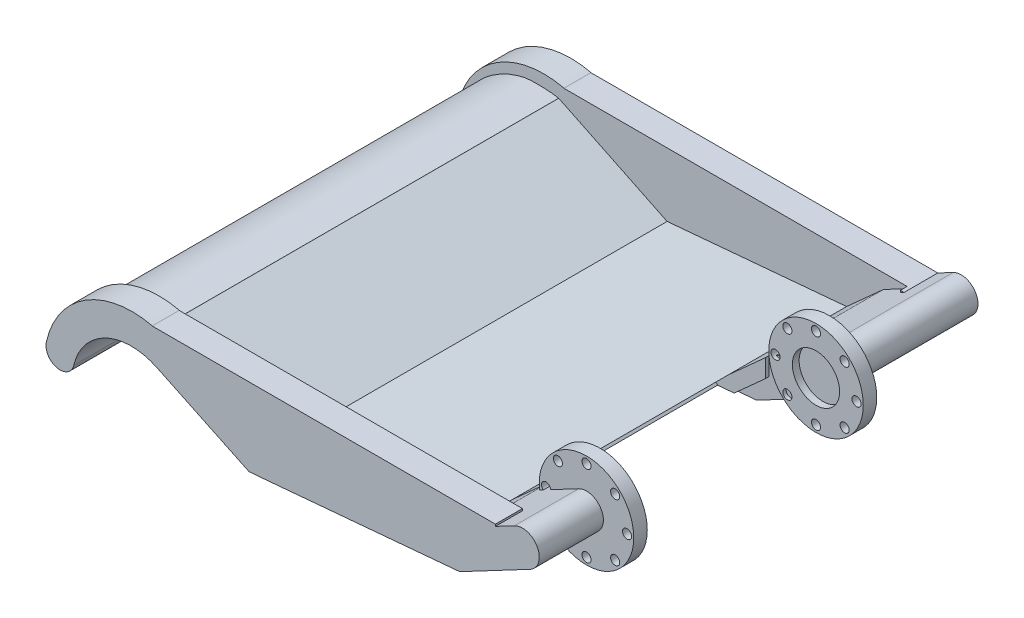
from build123d import *

# Parameters (mm, degrees)
EXTRUDE_1_DEPTH           = 150
CUT_EXTRUDE_START         = -4
CUT_EXTRUDE_1_DEPTH       = 142
EXTRUDE_2_DEPTH           = 10
EXTRUDE_3_DEPTH           = 146
CUT_EXTRUDE_2_DEPTH       = 182.252872433
CUT_EXTRUDE_2_DEPTH_BACK  = 182.252872433
SKETCH_13_W               = 7
SKETCH_13_H               = 142
CUT_EXTRUDE_3_DEPTH       = 10
CUT_EXTRUDE_4_DEPTH       = 182.247779062
CUT_EXTRUDE_4_DEPTH_BACK  = 182.247779062
CUT_EXTRUDE_5_DEPTH       = 182.247779062
CUT_EXTRUDE_5_DEPTH_BACK  = 182.247779062
CUT_EXTRUDE_6_DEPTH       = 183.008664647
CUT_EXTRUDE_6_DEPTH_BACK  = 183.008664647
EXTRUDE_4_DEPTH           = 4
EXTRUDE_START             = -150
EXTRUDE_5_DEPTH           = 4
EXTRUDE_6_DEPTH           = 142
EXTRUDE_7_DEPTH           = 33
SKETCH_23_R               = 14
SKETCH_23_R_2             = 1.35
EXTRUDE_8_DEPTH           = 4
SKETCH_24_R               = 2.5
EXTRUDE_9_DEPTH           = 4
SKETCH_25_W               = 20
SKETCH_25_H               = 64
CUT_EXTRUDE_7_DEPTH       = 4
EXTRUDE_10_DEPTH          = 4
SWEEP_START               = 4
SWEEP_1_DEPTH             = 142
SWEEP_2_DEPTH             = 142
SWEEP_4_DEPTH             = 142
SWEEP_5_DEPTH             = 142
SWEEP_6_DEPTH             = 142
EXTRUDE_13_DEPTH          = 150
EXTRUDE_START_2           = 4
EXTRUDE_14_DEPTH          = 142
EXTRUDE_15_DEPTH          = 42
SKETCH_38_W               = 150.834612216
SKETCH_38_H               = 73.301639105
CUT_EXTRUDE_10_DEPTH      = 69
EXTRUDE_16_DEPTH          = 4
SKETCH_42_R               = 7
CUT_EXTRUDE_11_DEPTH      = 2
CUT_EXTRUDE_START_2       = -2
SKETCH_43_R               = 7
CUT_EXTRUDE_12_DEPTH      = 2
CUT_EXTRUDE_13_DEPTH      = 173.219808533
CUT_EXTRUDE_13_DEPTH_BACK = 173.219808533
EXTRUDE_17_REACH          = 168.644
EXTRUDE_18_DEPTH          = 8
EXTRUDE_19_DEPTH          = 8
EXTRUDE_20_DEPTH          = 130


# Read off the part's stored shape, not the designer's step: 扫描1, 扫描2, 扫描4, 扫描5, 扫描6, 凸台-拉伸13
with BuildPart() as part:
    # 草图1 → 凸台-拉伸1 (new body)
    with BuildSketch(Plane.XY):
        with BuildLine():
            Line((0, 0), (84.371041787, 0))
            add(Edge.make_bspline(
                [(55.913923705, -38.035643557), (80.119272772, -28.628823463), (84.371041787, 0)],
                knots=[0, 0, 0, 1, 1, 1], degree=2))
            Line((55.913923705, -38.035643557), (46.3275244, -38.035643557))
            Line((46.3275244, -38.035643557), (45.93874262, -38.035643557))
            Line((45.93874262, -38.035643557), (-35.628958213, 0))
            Line((-35.628958213, 0), (0, 0))
        make_face()
    extrude(amount=EXTRUDE_1_DEPTH)

    # 草图2 → 切除-拉伸1 (cut)
    with BuildSketch(Plane.XY.offset(150).offset(CUT_EXTRUDE_START)):
        with BuildLine():
            Line((81.371041787, 0), (-28.530353464, 0))
            Line((-28.530353464, 0), (47.917706931, -35.648316013))
            add(Edge.make_bspline(
                [(47.917706931, -35.648316013), (74.149853948, -29.50839386), (81.371041787, 0)],
                knots=[0, 0, 0, 1, 1, 1], degree=2))
        make_face()
    extrude(amount=-CUT_EXTRUDE_1_DEPTH, mode=Mode.SUBTRACT)

    # 草图9 → 凸台-拉伸2 (add)
    with BuildSketch(Plane.XY):
        with BuildLine():
            Line((92.371041787, 0), (84.371041787, 0))
            add(Edge.make_bspline(
                [(83.660125503, -4), (84.066701304, -2.049243485), (84.371041787, 0)],
                knots=[0.928420269, 0.928420269, 0.928420269, 1, 1, 1], degree=2))
            Line((83.660125503, -4), (92.371041787, -4))
            ThreePointArc((92.371041787, -4), (94.371041787, -2), (92.371041787, 0))
        make_face()
    extrude_2 = extrude(amount=EXTRUDE_2_DEPTH)

    # 镜向1: 凸台-拉伸2 across plane
    add(extrude_2.mirror(Plane.XY.offset(75)))

    # 草图10 → 凸台-拉伸3 (add)
    with BuildSketch(Plane.XY.offset(150)):
        Polygon((45.886677586, -38.011365233), (83.660125513, -3.999999952), (82.12466932, 0), (41.948370108, -36.174902295), align=None)
    extrude(amount=-EXTRUDE_3_DEPTH)

    # 草图12 → 切除-拉伸2 (cut, two sides: drawn at the far end of the back side and taken through both)
    with BuildSketch(Plane.XY.offset(150).offset(-CUT_EXTRUDE_2_DEPTH_BACK)):
        Polygon((83.660125513, -3.999999952), (45.886677586, -38.011365233), (45.93874262, -38.035643557), (42.591069021, -42.580909955), (89.03622068, -36.427217632), align=None)
    extrude(amount=CUT_EXTRUDE_2_DEPTH + CUT_EXTRUDE_2_DEPTH_BACK, mode=Mode.SUBTRACT)

    # 草图13 → 切除-拉伸3 (cut)
    with BuildSketch(Plane(origin=(0, 0, 0), x_dir=(1, 0, 0), z_dir=(0, 1, 0))):
        with Locations((80.871041787, -75)):
            Rectangle(SKETCH_13_W, SKETCH_13_H)
    extrude(amount=-CUT_EXTRUDE_3_DEPTH, mode=Mode.SUBTRACT)

    # 草图15 → 切除-拉伸4 (cut, two sides: drawn at the far end of the back side and taken through both)
    with BuildSketch(Plane.XY.offset(150).offset(-CUT_EXTRUDE_4_DEPTH_BACK)):
        Polygon((-25.628958213, 0), (-25.628958213, -4.663076582), (-35.628958213, 0), align=None)
    extrude(amount=CUT_EXTRUDE_4_DEPTH + CUT_EXTRUDE_4_DEPTH_BACK, mode=Mode.SUBTRACT)

    # 草图17 → 切除-拉伸5 (cut, two sides: drawn at the far end of the back side and taken through both)
    with BuildSketch(Plane.XY.offset(150).offset(-CUT_EXTRUDE_5_DEPTH_BACK)):
        Polygon((45.886677586, -38.011365233), (-32.628958213, 0), (-39.208724499, 3.812604094), (-30.674699475, -18.213608816), align=None)
    extrude(amount=CUT_EXTRUDE_5_DEPTH + CUT_EXTRUDE_5_DEPTH_BACK, mode=Mode.SUBTRACT)

    # 草图19 → 切除-拉伸6 (cut, two sides: drawn at the far end of the back side and taken through both)
    with BuildSketch(Plane(origin=(-5.095697879, -10.927759366, 0), x_dir=(0.9063077870366788, -0.42261826174063777, 0), z_dir=(0.42261826174063777, 0.9063077870366788, 0)).offset(-CUT_EXTRUDE_6_DEPTH_BACK)):
        Polygon((-15.723057795, -4), (-15.723057795, 15.181197201), (-71.912310166, 15.181197201), (-28.952648141, -153.791833671), (-15.723057795, -153.791833671), align=None)
    extrude(amount=CUT_EXTRUDE_6_DEPTH + CUT_EXTRUDE_6_DEPTH_BACK, mode=Mode.SUBTRACT)

    # 草图20 → 凸台-拉伸4 (add)
    with BuildSketch(Plane(origin=(0, 0, 0), x_dir=(-1, 0, 0), z_dir=(0, 0, -1))):
        with BuildLine():
            Line((17.34847479, 0), (20.162737711, -6.03520631))
            add(Edge.make_bspline(
                [(20.162737711, -6.03520631), (22.66067339, -5.652547732), (27.363174773, -5.662392353), (30.160749267, -6.292319916), (35.979648976, -8.083174558), (40.608616668, -12.707453996)],
                knots=[0, 0, 0, 0, 0.459648514, 0.559648514, 1, 1, 1, 1], degree=3))
            add(Edge.make_bspline(
                [(17.34847479, 0), (19.92205597, 0), (24.300461519, 0.17777387), (32.199837859, -1.721775175), (39.374446968, -6.481992043), (40.608616668, -12.707453996)],
                knots=[0, 0, 0, 0, 0.365909974, 0.465909974, 1, 1, 1, 1], degree=3))
        make_face()
    extrude(amount=-EXTRUDE_4_DEPTH)

    # 草图20<2> → 凸台-拉伸5 (add)
    with BuildSketch(Plane(origin=(0, 0, 0), x_dir=(-1, 0, 0), z_dir=(0, 0, -1)).offset(EXTRUDE_START)):
        with BuildLine():
            add(Edge.make_bspline(
                [(17.34847479, 0), (19.92205597, 0), (24.300461519, 0.17777387), (32.199837859, -1.721775175), (39.374446968, -6.481992043), (40.608616668, -12.707453996)],
                knots=[0, 0, 0, 0, 0.365909974, 0.465909974, 1, 1, 1, 1], degree=3))
            Line((17.34847479, 0), (20.162737711, -6.03520631))
            add(Edge.make_bspline(
                [(20.162737711, -6.03520631), (22.66067339, -5.652547732), (27.363174773, -5.662392353), (30.160749267, -6.292319916), (35.979648976, -8.083174558), (40.608616668, -12.707453996)],
                knots=[0, 0, 0, 0, 0.459648514, 0.559648514, 1, 1, 1, 1], degree=3))
        make_face()
    extrude(amount=EXTRUDE_5_DEPTH)

    # 草图21 → 凸台-拉伸6 (add)
    with BuildSketch(Plane.XY.offset(4)):
        Polygon((45.886677586, -38.011365233), (48.294049161, -35.843758131), (-18.855499618, -3.334997324), (-20.162737711, -6.03520631), align=None)
    extrude(amount=EXTRUDE_6_DEPTH)


with BuildPart() as body_2:
    # 草图22 → 凸台-拉伸7 (new body)
    with BuildSketch(Plane.XY.offset(10)):
        with BuildLine():
            ThreePointArc((92.371041787, 0), (90.371041787, -2), (92.371041787, -4))
            ThreePointArc((92.371041787, -4), (93.785255349, -3.414213562), (94.371041787, -2))
            ThreePointArc((94.371041787, -2), (93.785255349, -0.585786438), (92.371041787, 0))
        make_face()
    extrude_7 = extrude(amount=EXTRUDE_7_DEPTH)


with BuildPart() as body_3:
    # 草图23 → 凸台-拉伸8 (new body)
    with BuildSketch(Plane.XY.offset(43)):
        with Locations((92.371041787, -2)):
            Circle(SKETCH_23_R)
        with Locations((92.371041787, 10)):
            Circle(SKETCH_23_R_2, mode=Mode.SUBTRACT)
        with Locations((100.856323161, 6.485281374)):
            Circle(SKETCH_23_R_2, mode=Mode.SUBTRACT)
        with Locations((104.371041787, -2)):
            Circle(SKETCH_23_R_2, mode=Mode.SUBTRACT)
        with Locations((100.856323161, -10.485281374)):
            Circle(SKETCH_23_R_2, mode=Mode.SUBTRACT)
        with Locations((92.371041787, -14)):
            Circle(SKETCH_23_R_2, mode=Mode.SUBTRACT)
        with Locations((83.885760413, -10.485281374)):
            Circle(SKETCH_23_R_2, mode=Mode.SUBTRACT)
        with Locations((80.371041787, -2)):
            Circle(SKETCH_23_R_2, mode=Mode.SUBTRACT)
        with Locations((83.885760413, 6.485281374)):
            Circle(SKETCH_23_R_2, mode=Mode.SUBTRACT)
    extrude_8 = extrude(amount=-EXTRUDE_8_DEPTH)


with BuildPart() as part_1:
    add(part.part)

    # 镜向2: 凸台-拉伸7 across plane
    add(extrude_7.mirror(Plane.XY.offset(75)))

    # 镜向3: 凸台-拉伸8 across plane
    add(extrude_8.mirror(Plane.XY.offset(75)))

    # 草图25 → 切除-拉伸7 (cut)
    with BuildSketch(Plane(origin=(36.77015192, -40.837390894, 0), x_dir=(0.7431448254773977, 0.6691306063588546, 0), z_dir=(-0.6691306063588546, 0.7431448254773977, 0))):
        with Locations((44.633886256, -75)):
            Rectangle(SKETCH_25_W, SKETCH_25_H)
    extrude(amount=-CUT_EXTRUDE_7_DEPTH, mode=Mode.SUBTRACT)



with BuildPart() as body_4:
    # 草图24 → 凸台-拉伸9 (new body)
    with BuildSketch(Plane.XY.offset(150)):
        with Locations((-46.162737711, -20)):
            Circle(SKETCH_24_R)
    extrude(amount=-EXTRUDE_9_DEPTH)


with BuildPart() as body_5:
    # 镜向5: mirrored copy
    add(body_4.part.mirror(Plane.XY.offset(75)))


with BuildPart() as part_2:
    add(part_1.part)

    add(body_4.part)  # 凸台-拉伸10 merges body 4
    # 草图30 → 凸台-拉伸10 (add)
    with BuildSketch(Plane.XY.offset(150)):
        with BuildLine():
            add(Edge.make_bspline(
                [(-17.361804974, 1.243e-06), (-19.933921762, 0.00047988), (-24.305449129, 0.176574508), (-32.199837859, -1.721775175), (-39.374446968, -6.481992043), (-40.608616668, -12.707453996)],
                knots=[0.000631393, 0.000631393, 0.000631393, 0.000631393, 0.365909974, 0.465909974, 1, 1, 1, 1], degree=3))
            Line((-17.361804974, 1.243e-06), (-17.286541526, 0.044151217))
            ThreePointArc((-17.286541526, 0.044151217), (-36.995473472, -3.185414802), (-48.599294605, -19.440365745))
            ThreePointArc((-48.599294605, -19.440365745), (-46.194749763, -17.500204963), (-43.741310686, -19.37815503))
            ThreePointArc((-43.741310686, -19.37815503), (-42.101235507, -15.27422661), (-39.525601088, -11.682822647))
            add(Edge.make_bspline(
                [(-39.525601088, -11.682822647), (-39.886354477, -12.0058354), (-40.24782898, -12.347031717), (-40.608616668, -12.707453996)],
                knots=[0.96567844, 0.96567844, 0.96567844, 0.96567844, 1, 1, 1, 1], degree=3))
        make_face()
    extrude_10 = extrude(amount=-EXTRUDE_10_DEPTH)

    # 镜向7: 凸台-拉伸10 across plane
    add(extrude_10.mirror(Plane.XY.offset(75)))

    # 扫描1 outline → 扫描1 (add)
    with BuildSketch(Plane.XY.offset(SWEEP_START)):
        with BuildLine():
            Line((-40.359499641, -9.938451278), (-39.525601088, -11.682822647))
            add(Edge.make_bspline(
                [(-39.525601088, -11.682822647), (-37.391713968, -9.772174618), (-35.283057384, -8.497737422), (-31.698971246, -6.78981865), (-30.223541725, -6.356337092), (-28.92883316, -6.014930371), (-28.649075758, -5.951937626), (-27.396040293, -5.780259789), (-25.993917265, -5.718425153), (-23.001749877, -5.750233764), (-21.411705546, -5.843877026), (-20.162737711, -6.03520631)],
                knots=[0, 0, 0, 0, 0.210230398, 0.210230398, 0.420460797, 0.420460797, 0.524014936, 0.524014936, 0.762007468, 0.762007468, 1, 1, 1, 1], degree=3))
            Line((-20.162737711, -6.03520631), (-19.345627594, -4.282908011))
            add(Edge.make_bspline(
                [(-40.359499641, -9.938451278), (-38.03938458, -7.938537704), (-35.747801683, -6.614334919), (-31.851708044, -4.855945924), (-30.234072212, -4.421931688), (-28.847183327, -4.082968243), (-28.444896136, -4.027547987), (-26.923919783, -3.895861941), (-25.495125385, -3.849255475), (-22.376450407, -3.919499158), (-20.725652055, -4.028782308), (-19.345627594, -4.282908011)],
                knots=[0, 0, 0, 0, 0.210230398, 0.210230398, 0.420460797, 0.420460797, 0.524014936, 0.524014936, 0.762007468, 0.762007468, 1, 1, 1, 1], degree=3))
        make_face()
    extrude(amount=SWEEP_1_DEPTH)


    add(body_5.part)  # 扫描2 merges body 5
    # 扫描2 outline → 扫描2 (add)
    with BuildSketch(Plane.XY.offset(SWEEP_START)):
        with BuildLine():
            Line((-45.291038107, -18.222056768), (-43.741310686, -19.37815503))
            ThreePointArc((-43.741310686, -19.37815503), (-42.101235507, -15.274226609), (-39.525601088, -11.682822647))
            Line((-39.525601088, -11.682822647), (-40.359499641, -9.938451278))
            ThreePointArc((-40.359499641, -9.938451278), (-43.328808115, -13.780478383), (-45.291038107, -18.222056768))
        make_face()
    extrude(amount=SWEEP_2_DEPTH)

    # 扫描4 outline → 扫描4 (add)
    with BuildSketch(Plane.XY.offset(SWEEP_START)):
        Polygon((-18.855499618, -3.334997324), (-18.880970466, -3.323120072), (-19.345627594, -4.282908011), (-19.320156747, -4.294785262), align=None)
    extrude(amount=SWEEP_4_DEPTH)

    # 扫描5 outline → 扫描5 (add)
    with BuildSketch(Plane.XY.offset(SWEEP_START)):
        with BuildLine():
            add(Edge.make_bspline(
                [(-40.816256515, -8.974878607), (-38.391889395, -6.925241015), (-36.000392341, -5.574532499), (-32.946671955, -4.23514457), (-32.014835751, -3.903393229), (-30.817762218, -3.5309807), (-30.452065305, -3.42769871), (-29.7998577, -3.254956896), (-29.52566126, -3.185141268), (-29.025880923, -3.073560275), (-28.765000893, -3.034662116), (-28.276124787, -2.975855713), (-28.034143944, -2.956484287), (-26.669625139, -2.858422023), (-25.221818375, -2.817952966), (-22.037290505, -2.907940726), (-20.34677292, -3.0270334), (-18.880970466, -3.323120072)],
                knots=[0, 0, 0, 0, 0.210230398, 0.210230398, 0.315345597, 0.315345597, 0.367903197, 0.367903197, 0.420460797, 0.420460797, 0.472237866, 0.472237866, 0.524014936, 0.524014936, 0.762007468, 0.762007468, 1, 1, 1, 1], degree=3))
            Line((-40.816256515, -8.974878607), (-40.359499641, -9.938451278))
            add(Edge.make_bspline(
                [(-40.359499641, -9.938451278), (-38.03938458, -7.938537704), (-35.747801683, -6.614334919), (-31.851708044, -4.855945924), (-30.234072212, -4.421931688), (-28.847183327, -4.082968243), (-28.444896136, -4.027547987), (-26.923919783, -3.895861941), (-25.495125385, -3.849255475), (-22.376450407, -3.919499158), (-20.725652055, -4.028782308), (-19.345627594, -4.282908011)],
                knots=[0, 0, 0, 0, 0.210230398, 0.210230398, 0.420460797, 0.420460797, 0.524014936, 0.524014936, 0.762007468, 0.762007468, 1, 1, 1, 1], degree=3))
            Line((-19.345627594, -4.282908011), (-18.880970466, -3.323120072))
        make_face()
    extrude(amount=SWEEP_5_DEPTH)

    # 扫描6 outline → 扫描6 (add)
    with BuildSketch(Plane.XY.offset(SWEEP_START)):
        with BuildLine():
            ThreePointArc((-40.816256515, -8.974878607), (-44.003139485, -12.954417649), (-46.143656955, -17.581634849))
            Line((-46.143656955, -17.581634849), (-45.291038107, -18.222056768))
            ThreePointArc((-45.291038107, -18.222056768), (-43.328808115, -13.780478383), (-40.359499641, -9.938451278))
            Line((-40.359499641, -9.938451278), (-40.816256515, -8.974878607))
        make_face()
    extrude(amount=SWEEP_6_DEPTH)

    # 凸台-拉伸13 outline → 凸台-拉伸13 (add)
    with BuildSketch(Plane(origin=(0, 0, 0), x_dir=(-1, 0, 0), z_dir=(0, 0, -1)).offset(EXTRUDE_START)):
        with BuildLine():
            Line((48.599294605, -19.440365745), (43.741310686, -19.37815503))
            ThreePointArc((43.741310686, -19.37815503), (42.101235507, -15.274226609), (39.525601088, -11.682822647))
            add(Edge.make_bspline(
                [(23.720192871, -5.749523832), (25.496241827, -5.698874343), (27.895603388, -5.78227887), (30.064732145, -6.270699819), (35.257826852, -7.861526582), (39.525601088, -11.682822647)],
                knots=[0.19031794, 0.19031794, 0.19031794, 0.19031794, 0.459648514, 0.559648514, 0.96567844, 0.96567844, 0.96567844, 0.96567844], degree=3))
            ThreePointArc((23.720192871, -5.749523832), (36.891719451, -10.861580292), (43.398015701, -23.403124966))
            ThreePointArc((43.398015701, -23.403124966), (47.361193605, -23.452620302), (48.645011049, -19.702814753))
            ThreePointArc((48.645011049, -19.702814753), (48.625651145, -19.570980871), (48.599294605, -19.440365745))
        make_face()
    extrude(amount=EXTRUDE_13_DEPTH)

    # 草图36 → 凸台-拉伸14 (add)
    with BuildSketch(Plane.XY.offset(EXTRUDE_START_2)):
        with BuildLine():
            Line((-46.143656955, -17.581634849), (-43.741310686, -19.37815503))
            Line((-43.741310686, -19.37815503), (-46.645776979, -19.415349251))
            ThreePointArc((-46.645776979, -19.415349251), (-46.415359069, -18.49283969), (-46.143656955, -17.581634849))
        make_face()
    extrude(amount=EXTRUDE_14_DEPTH)


    add(body_2.part)  # 凸台-拉伸15 merges body 2

    add(body_3.part)  # 凸台-拉伸15 merges body 3
    # 草图37 → 凸台-拉伸15 (add)
    with BuildSketch(Plane(origin=(0, 0, 0), x_dir=(-1, 0, 0), z_dir=(0, 0, -1))):
        with BuildLine():
            ThreePointArc((-87.788466081, -3.999999975), (-90.721063972, -6.719912415), (-94.709519235, -6.419448294))
            Line((-94.709519235, -6.419448294), (-61.395909842, -24.046789786))
            Line((-61.395909842, -24.046789786), (-83.660125513, -3.999999952))
            Line((-83.660125513, -3.999999952), (-87.788466081, -3.999999975))
        make_face()
        with BuildLine():
            Line((-77.371041787, -4.280185456), (-85.460090636, 0))
            Line((-85.460090636, 0), (-87.788466092, 0))
            ThreePointArc((-87.788466092, 0), (-87.476510222, -0.978451782), (-87.371041787, -2))
            ThreePointArc((-87.371041787, -2), (-87.476510221, -3.021548212), (-87.788466086, -3.999999987))
            Line((-87.788466086, -3.999999975), (-83.660125513, -3.999999952))
            Line((-83.660125513, -3.999999952), (-61.395909842, -24.046789786))
            Line((-61.395909842, -24.046789786), (-77.371041787, -4.280185456))
        make_face()
        with BuildLine():
            Line((-85.460090636, 0), (-90.032564339, 2.419448294))
            ThreePointArc((-90.032564339, 2.419448294), (-88.70516172, 1.400194603), (-87.788466092, 0))
            Line((-87.788466092, 0), (-85.460090636, 0))
        make_face()
        with BuildLine():
            ThreePointArc((-87.371041787, -2), (-87.476510222, -0.978451782), (-87.788466092, 0))
            Line((-87.788466092, 0), (-92.371041787, 0))
            ThreePointArc((-92.371041787, 0), (-94.371041787, -2), (-92.371041787, -4))
            Line((-92.371041787, -4), (-87.788466081, -3.999999975))
            ThreePointArc((-87.788466081, -3.999999975), (-87.476510219, -3.021548205), (-87.371041787, -2))
        make_face()
        with BuildLine():
            ThreePointArc((-87.788466092, 0), (-88.70516172, 1.400194603), (-90.032564339, 2.419448294))
            ThreePointArc((-90.032564339, 2.419448294), (-96.790490081, 0.338477448), (-94.709519235, -6.419448294))
            ThreePointArc((-94.709519235, -6.419448294), (-90.721063972, -6.719912415), (-87.788466081, -3.999999975))
            Line((-87.788466081, -3.999999975), (-92.371041787, -4))
            ThreePointArc((-92.371041787, -4), (-94.371041787, -2), (-92.371041787, 0))
            Line((-92.371041787, 0), (-87.788466092, 0))
        make_face()
    extrude_15 = extrude(amount=-EXTRUDE_15_DEPTH)

    # 镜向9: 凸台-拉伸15 across plane
    add(extrude_15.mirror(Plane.XY.offset(75)))

    # 草图38 → 切除-拉伸10 (cut)
    with BuildSketch(Plane.XY.offset(130)):
        with Locations((23.748854463, -26.570841636)):
            Rectangle(SKETCH_38_W, SKETCH_38_H)
    extrude(amount=CUT_EXTRUDE_10_DEPTH, mode=Mode.SUBTRACT)

    # 草图42 → 切除-拉伸11 (cut)
    with BuildSketch(Plane.XY.offset(43)):
        with Locations((92.371041787, -2)):
            Circle(SKETCH_42_R)
    extrude(amount=-CUT_EXTRUDE_11_DEPTH, mode=Mode.SUBTRACT)

    # 草图43 → 切除-拉伸12 (cut)
    with BuildSketch(Plane(origin=(0, 0, 107), x_dir=(-1, 0, 0), z_dir=(0, 0, -1)).offset(CUT_EXTRUDE_START_2)):
        with Locations(Location((-92.371041787, -2, 0), (0, 0, 180))):
            Circle(SKETCH_43_R)
    extrude(amount=CUT_EXTRUDE_12_DEPTH, mode=Mode.SUBTRACT)


with BuildPart() as body_2_2:
    # 草图40 → 凸台-拉伸16 (new body)
    with BuildSketch(Plane.XY.offset(130)):
        with BuildLine():
            Line((44.406422693, -33.961661806), (77.371041787, -4.280185456))
            Line((77.371041787, -4.280185456), (84.371041787, -0.576252058))
            Line((84.371041787, -0.576252058), (84.371041787, 0))
            Line((84.371041787, 0), (-17.34847479, 0))
            Line((-17.34847479, 0), (-17.36180497, 1.245e-06))
            Line((-17.36180497, 1.245e-06), (-17.286541526, 0.044151217))
            ThreePointArc((-17.286541526, 0.044151217), (-36.995473472, -3.185414802), (-48.599294605, -19.440365745))
            Line((-48.599294605, -19.440365745), (-46.645776979, -19.415349251))
            ThreePointArc((-46.645776979, -19.415349251), (-44.485259041, -13.773976699), (-40.816256515, -8.974878607))
            add(Edge.make_bspline(
                [(-40.816256515, -8.974878607), (-38.391889395, -6.925241015), (-36.000392341, -5.574532499), (-32.946671955, -4.23514457), (-32.014835751, -3.903393229), (-30.817762218, -3.5309807), (-30.452065305, -3.42769871), (-29.7998577, -3.254956896), (-29.52566126, -3.185141268), (-29.025880923, -3.073560275), (-28.765000893, -3.034662116), (-28.276124787, -2.975855713), (-28.034143944, -2.956484287), (-26.669625139, -2.858422023), (-25.221818375, -2.817952966), (-22.037290505, -2.907940726), (-20.34677292, -3.0270334), (-18.880970466, -3.323120072)],
                knots=[0, 0, 0, 0, 0.210230398, 0.210230398, 0.315345597, 0.315345597, 0.367903197, 0.367903197, 0.420460797, 0.420460797, 0.472237866, 0.472237866, 0.524014936, 0.524014936, 0.762007468, 0.762007468, 1, 1, 1, 1], degree=3))
            Line((-18.880970466, -3.323120072), (-18.855499618, -3.334997324))
            Line((-18.855499618, -3.334997324), (44.406422693, -33.961661806))
        make_face()
    extrude(amount=-EXTRUDE_16_DEPTH)


with BuildPart() as cut_extrude_13_tool:
    # 草图44 → 切除-拉伸13 (new, two sides: drawn at the far end of the back side and taken through both)
    with BuildSketch(Plane.XY.offset(-CUT_EXTRUDE_13_DEPTH_BACK)):
        Polygon((14.445760351, -22.790037963), (73.799015243, -17.483893166), (45.433568973, -45.247222088), align=None)
    extrude(amount=CUT_EXTRUDE_13_DEPTH + CUT_EXTRUDE_13_DEPTH_BACK)


with BuildPart() as part_3:
    add(part_2.part)

    # 切除-拉伸13: cut by cut_extrude_13_tool
    add(cut_extrude_13_tool.part, mode=Mode.SUBTRACT)


with BuildPart() as body_2_2_1:
    add(body_2_2.part)

    # 切除-拉伸13: cut by cut_extrude_13_tool
    add(cut_extrude_13_tool.part, mode=Mode.SUBTRACT)

    # 凸台-拉伸17: up to this face of the body (flat: up to its plane)
    extrude_17_end = Plane(body_2_2_1.part.faces().sort_by_distance((28.656465184, -8.619649365, 126))[0])
    # 草图46 → 凸台-拉伸17 (add, up to the picked face)
    with BuildSketch(Plane.XY.offset(4), mode=Mode.PRIVATE) as extrude_17_sk1:
        Polygon((14.445760351, -22.790037963), (61.484116044, -18.584837646), (66.435940514, -14.126194867), (7.443522485, -19.400081068), align=None)
    extrude_17_tool1 = split(extrude(extrude_17_sk1.sketch, amount=EXTRUDE_17_REACH, mode=Mode.PRIVATE), bisect_by=extrude_17_end, keep=Keep.BOTH, mode=Mode.PRIVATE)

    add(part_3.part)  # 凸台-拉伸17 merges part
    add(extrude_17_tool1.solids().sort_by(Axis((37.433071, -18.651549, 4), (0, 0, 1)))[0])

    # 草图47 → 凸台-拉伸18 (add)
    with BuildSketch(Plane.XY.offset(130)):
        with BuildLine():
            Line((-20.162737711, -6.03520631), (14.445760351, -22.790037963))
            Line((14.445760351, -22.790037963), (73.799015243, -17.483893166))
            Line((73.799015243, -17.483893166), (94.709519235, -6.419448294))
            ThreePointArc((94.709519235, -6.419448294), (96.790490081, 0.338477448), (90.032564339, 2.419448294))
            Line((90.032564339, 2.419448294), (84.371041787, -0.576252058))
            Line((84.371041787, -0.576252058), (84.371041787, 0))
            Line((84.371041787, 0), (-17.34847479, 0))
            Line((-17.34847479, 0), (-17.36180497, 1.245e-06))
            Line((-17.36180497, 1.245e-06), (-17.286541526, 0.044151217))
            ThreePointArc((-17.286541526, 0.044151217), (-36.995473472, -3.185414802), (-48.599294605, -19.440365745))
            ThreePointArc((-48.599294605, -19.440365745), (-48.625651145, -19.570980871), (-48.645011049, -19.702814753))
            ThreePointArc((-48.645011049, -19.702814753), (-47.361193605, -23.452620302), (-43.398015701, -23.403124966))
            ThreePointArc((-43.398015701, -23.403124966), (-36.891719456, -10.861580297), (-23.720192885, -5.749523832))
            add(Edge.make_bspline(
                [(-23.720192885, -5.749523832), (-22.465177626, -5.785314446), (-21.197010549, -5.876766135), (-20.162737711, -6.03520631)],
                knots=[0.802917894, 0.802917894, 0.802917894, 0.802917894, 1, 1, 1, 1], degree=3))
        make_face()
    extrude(amount=-EXTRUDE_18_DEPTH)

    # 草图48 → 凸台-拉伸19 (add)
    with BuildSketch(Plane(origin=(0, 0, 0), x_dir=(-1, 0, 0), z_dir=(0, 0, -1))):
        with BuildLine():
            Line((-73.799015243, -17.483893166), (-14.445760351, -22.790037963))
            Line((-14.445760351, -22.790037963), (20.162737711, -6.03520631))
            add(Edge.make_bspline(
                [(20.162737711, -6.03520631), (21.197010549, -5.876766132), (22.465177615, -5.785314445), (23.720192871, -5.749523832)],
                knots=[0, 0, 0, 0, 0.19031794, 0.19031794, 0.19031794, 0.19031794], degree=3))
            ThreePointArc((23.720192871, -5.749523832), (36.891719451, -10.861580292), (43.398015701, -23.403124966))
            ThreePointArc((43.398015701, -23.403124966), (47.361193605, -23.452620302), (48.645011049, -19.702814753))
            ThreePointArc((48.645011049, -19.702814753), (48.625651145, -19.570980871), (48.599294605, -19.440365745))
            ThreePointArc((48.599294605, -19.440365745), (36.995473472, -3.185414802), (17.286541526, 0.044151217))
            Line((17.286541526, 0.044151217), (17.36180497, 1.245e-06))
            Line((17.36180497, 1.245e-06), (17.34847479, 0))
            Line((17.34847479, 0), (-85.460090636, 0))
            Line((-85.460090636, 0), (-90.032564339, 2.419448294))
            ThreePointArc((-90.032564339, 2.419448294), (-96.790490081, 0.338477448), (-94.709519235, -6.419448294))
            Line((-94.709519235, -6.419448294), (-73.799015243, -17.483893166))
        make_face()
    extrude(amount=-EXTRUDE_19_DEPTH)

    # 草图49 → 凸台-拉伸20 (add)
    with BuildSketch(Plane(origin=(0, 0, 0), x_dir=(-1, 0, 0), z_dir=(0, 0, -1))):
        with BuildLine():
            Line((20.162737711, -6.03520631), (-14.445760351, -22.790037963))
            Line((-14.445760351, -22.790037963), (-11.358261801, -23.030542422))
            Line((-11.358261801, -23.030542422), (15.989444997, -9.959470053))
            ThreePointArc((15.989444997, -9.959470053), (31.091162822, -9.963556344), (40.566635942, -21.72269352))
            ThreePointArc((40.566635942, -21.72269352), (45.082905281, -24.906414379), (48.790731235, -20.809489442))
            ThreePointArc((48.790731235, -20.809489442), (46.87834385, -23.736347054), (43.398015701, -23.403124966))
            ThreePointArc((43.398015701, -23.403124966), (36.891719451, -10.861580292), (23.720192871, -5.749523832))
            add(Edge.make_bspline(
                [(20.162737711, -6.03520631), (21.197010549, -5.876766132), (22.465177615, -5.785314445), (23.720192871, -5.749523832)],
                knots=[0, 0, 0, 0, 0.19031794, 0.19031794, 0.19031794, 0.19031794], degree=3))
        make_face()
    extrude(amount=-EXTRUDE_20_DEPTH)


solid = body_2_2_1.part
